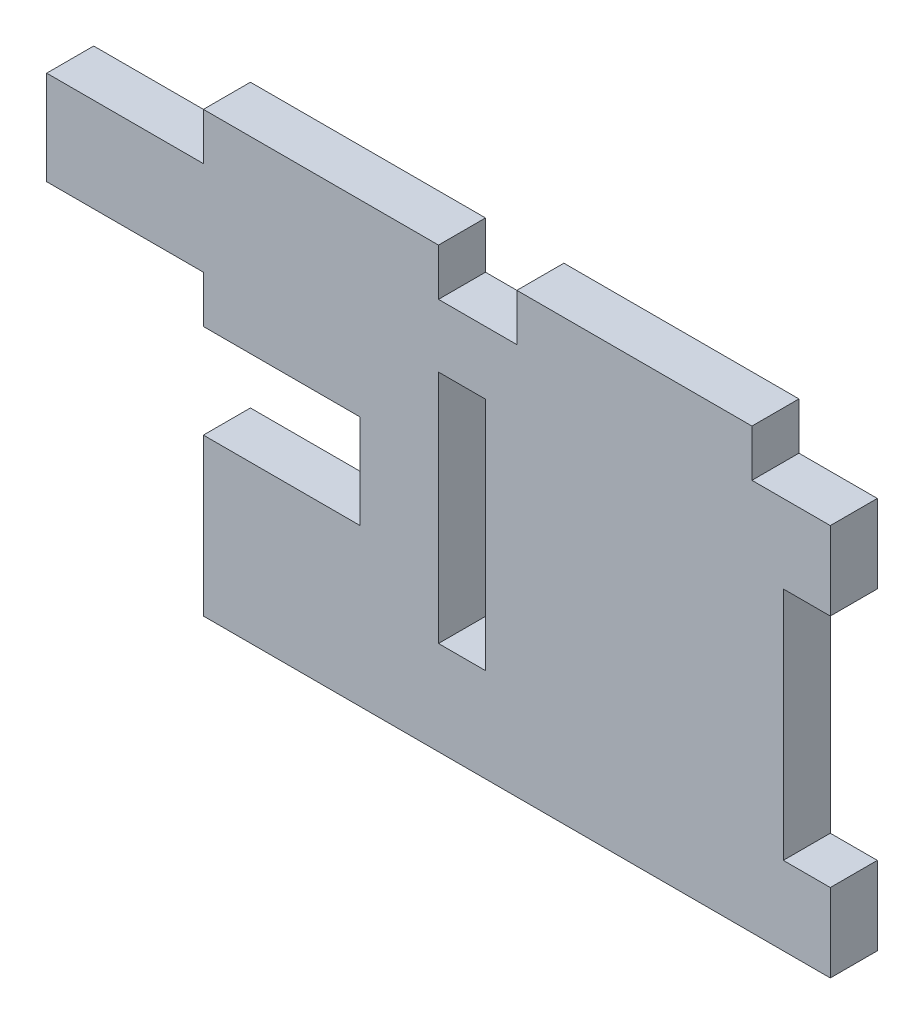
from build123d import *

# Parameters (mm, degrees)
SKETCH2_W           = 15
SKETCH2_H           = 6
SKETCH2_W_2         = 3
SKETCH2_H_2         = 15
BOSS_EXTRUDE1_DEPTH = 3
CUT_EXTRUDE1_DEPTH  = 37.488479636


with BuildPart() as part:
    # Sketch2 → Boss-Extrude1 (new body)
    with BuildSketch(Plane.XY):
        Polygon((-22.073806452, 10.862903226), (-22.073806452, 7.862903226), (-32.073806452, 7.862903226), (-32.073806452, -17.137096774), (17.926193548, -17.137096774), (17.926193548, -12.137096774), (14.926193548, -12.137096774), (14.926193548, 2.862903226), (17.926193548, 2.862903226), (17.926193548, 7.862903226), (12.926193548, 7.862903226), (12.926193548, 10.862903226), (-2.073806452, 10.862903226), (-2.073806452, 7.862903226), (-7.073806452, 7.862903226), (-7.073806452, 10.862903226), align=None)
        with Locations((-19.573806452, -4.137096774)):
            Rectangle(SKETCH2_W, SKETCH2_H, mode=Mode.SUBTRACT)
        with Locations((-5.573806452, -3.653225806)):
            Rectangle(SKETCH2_W_2, SKETCH2_H_2, mode=Mode.SUBTRACT)
    extrude(amount=BOSS_EXTRUDE1_DEPTH)

    # Sketch4 → Cut-Extrude1 (cut, through all)
    with BuildSketch(Plane.XY.offset(3)):
        Polygon((-32.073806452, 1.862903226), (-22.522991459, 1.862903226), (-22.073806452, 1.862903226), (-22.073806452, -17.137096774), (-32.073806452, -17.137096774), align=None)
    extrude(amount=-CUT_EXTRUDE1_DEPTH, mode=Mode.SUBTRACT)


solid = part.part
